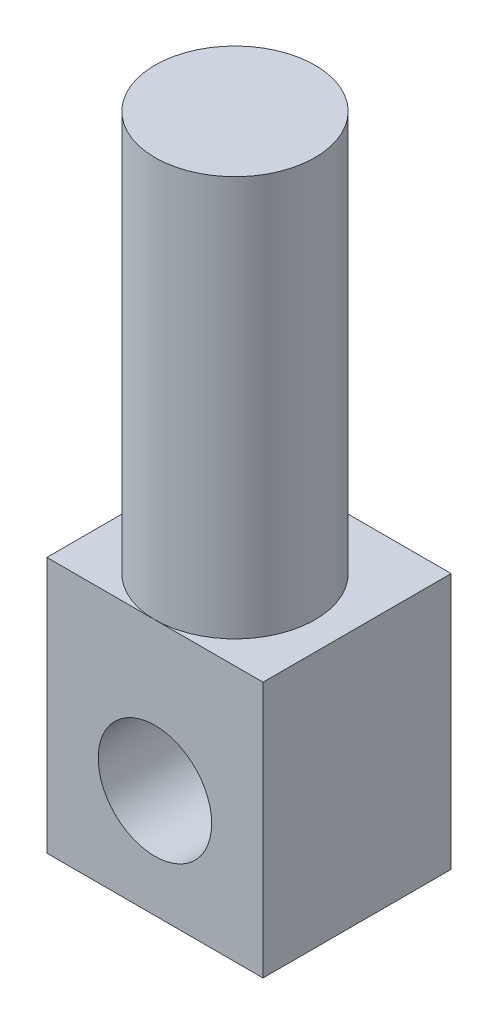
from build123d import *

# Parameters (mm, degrees)
SKETCH1_W            = 6.858
SKETCH1_H            = 6.858
BOSS_EXTRUDE1_DEPTH  = 6.858
CUT_EXTRUDE1_DEPTH   = 6.858
BOSS_EXTRUDE2_DEPTH  = 12.7
MOVE_FACE1_BY        = 0.889
MOVE_START           = 68.758370303
MOVE_FACE2_OUTLINE_W = 1.27
MOVE_FACE2_OUTLINE_H = 5.969
MOVE_FACE2_DEPTH     = 6.858
MOVE_FACE3_BY        = 1.27


# Read off the part's stored shape, not the designer's step: Move Face2
with BuildPart() as part:
    # Sketch1 → Boss-Extrude1 (new body)
    with BuildSketch(Plane.XY):
        with Locations((72.187370303, 7.35377716)):
            Rectangle(SKETCH1_W, SKETCH1_H)
    extrude(amount=BOSS_EXTRUDE1_DEPTH)

    # Sketch3 → Cut-Extrude1 (cut)
    with BuildSketch(Plane.XY.offset(6.858)):
        with BuildLine():
            ThreePointArc((73.987370303, 7.35377716), (72.187370303, 9.15377716), (70.387370303, 7.35377716))
            Line((70.387370303, 7.35377716), (73.987370303, 7.35377716))
        make_face()
        with BuildLine():
            Line((73.987370303, 7.35377716), (70.387370303, 7.35377716))
            ThreePointArc((70.387370303, 7.35377716), (72.187370303, 5.55377716), (73.987370303, 7.35377716))
        make_face()
    extrude(amount=-CUT_EXTRUDE1_DEPTH, mode=Mode.SUBTRACT)

    # Sketch5 → Boss-Extrude2 (add)
    with BuildSketch(Plane(origin=(0, 10.78277716, 0), x_dir=(1, 0, 0), z_dir=(0, 1, 0))):
        with BuildLine():
            ThreePointArc((72.187370303, -0.889), (69.647370303, -3.429), (72.187370303, -5.969))
            Line((72.187370303, -5.969), (72.187370303, -0.889))
        make_face()
        with BuildLine():
            Line((72.187370303, -0.889), (72.187370303, -5.969))
            ThreePointArc((72.187370303, -5.969), (73.983421527, -5.225051224), (74.727370303, -3.429))
            ThreePointArc((74.727370303, -3.429), (73.983421527, -1.632948776), (72.187370303, -0.889))
        make_face()
    extrude(amount=BOSS_EXTRUDE2_DEPTH)

    # Move Face1: a face moved inward by 0.889
    extrude(part.faces().sort_by_distance((72.187370303, 4.61057716, 6.858))[0], amount=MOVE_FACE1_BY, dir=(0, 0, -1), mode=Mode.SUBTRACT)

    # Move Face2 outline → Move Face2 (add)
    with BuildSketch(Plane.YZ.offset(MOVE_START)):
        with Locations((11.41777716, 2.9845)):
            Rectangle(MOVE_FACE2_OUTLINE_W, MOVE_FACE2_OUTLINE_H)
    extrude(amount=MOVE_FACE2_DEPTH)

    # Move Face3: a face moved outward by 1.27
    extrude(part.faces().sort_by_distance((72.187370303, 23.48277716, 3.429))[0], amount=MOVE_FACE3_BY, dir=(0, 1, 0))


solid = part.part
